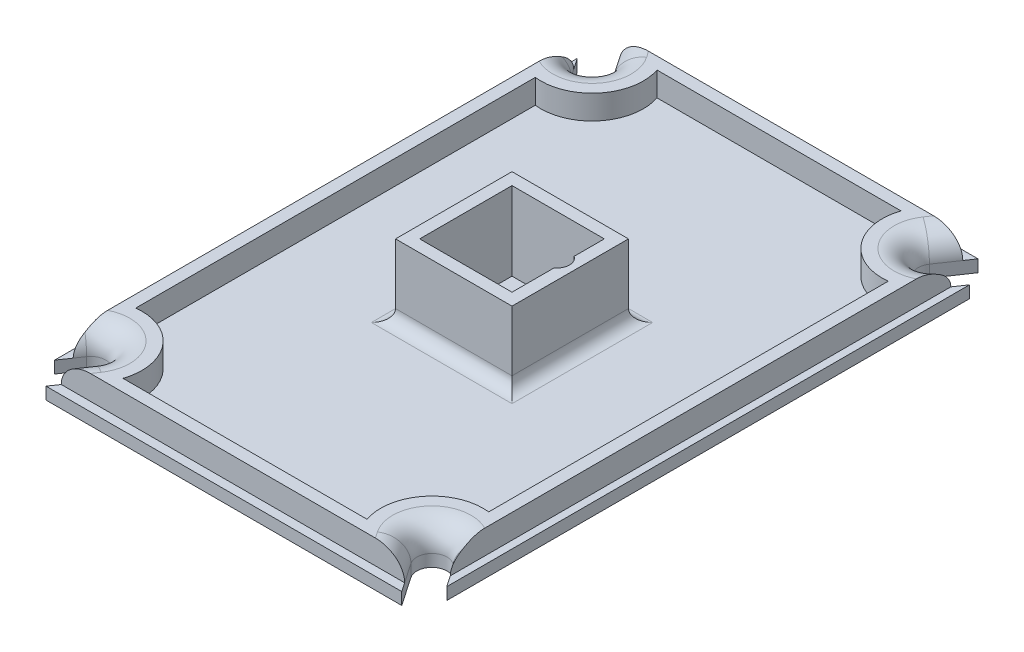
from build123d import *

# Parameters (mm, degrees)
SKETCH1_W           = 65
SKETCH1_H           = 95.5
BOSS_EXTRUDE1_DEPTH = 2
SKETCH1_3_W         = 62.5
SKETCH1_3_H         = 92.5
BOSS_EXTRUDE2_DEPTH = 6
BOSS_EXTRUDE3_START = 6
SKETCH2_4_W         = 19.3
SKETCH2_4_H         = 19.3
BOSS_EXTRUDE3_DEPTH = 8
SKETCH2_R           = 7.65
CUT_EXTRUDE1_DEPTH  = 19.5
CUT_EXTRUDE2_START  = 40
CUT_EXTRUDE2_DEPTH  = 39
CUT_EXTRUDE3_DEPTH  = 10
FILLET1_R           = 4
SKETCH5_W           = 19.3
SKETCH5_H           = 19.3
CUT_EXTRUDE5_DEPTH  = 4
FILLET2_R           = 2


with BuildPart() as part:
    # Sketch1 → Boss-Extrude1 (new body)
    with BuildSketch(Plane(origin=(0, 0, 0), x_dir=(1, 0, 0), z_dir=(0, 1, 0))):
        Rectangle(SKETCH1_W, SKETCH1_H)
    extrude(amount=BOSS_EXTRUDE1_DEPTH)

    # Sketch1<3> → Boss-Extrude2 (add)
    with BuildSketch(Plane(origin=(0, 0, 0), x_dir=(1, 0, 0), z_dir=(0, 1, 0))):
        Rectangle(SKETCH1_3_W, SKETCH1_3_H)
    extrude(amount=BOSS_EXTRUDE2_DEPTH)

    # Sketch2<4> → Boss-Extrude3 (add)
    with BuildSketch(Plane(origin=(0, 0, 0), x_dir=(1, 0, 0), z_dir=(0, 1, 0)).offset(BOSS_EXTRUDE3_START)):
        Rectangle(SKETCH2_4_W, SKETCH2_4_H)
    extrude(amount=BOSS_EXTRUDE3_DEPTH)

    # Sketch2 → Cut-Extrude1 (cut, symmetric)
    with BuildSketch(Plane(origin=(0, 0, 0), x_dir=(1, 0, 0), z_dir=(0, 1, 0))):
        with Locations(Location((0, 0, 0), (0, 0, 270))):
            Circle(SKETCH2_R)
    extrude(amount=CUT_EXTRUDE1_DEPTH, both=True, mode=Mode.SUBTRACT)

    # Sketch2<3> → Cut-Extrude2 (cut)
    with BuildSketch(Plane(origin=(0, 0, 0), x_dir=(1, 0, 0), z_dir=(0, 1, 0)).offset(CUT_EXTRUDE2_START)):
        with BuildLine():
            Line((9e-09, 7.65), (-7.65, 7.65))
            Line((-7.65, 7.65), (-7.65, 0))
            ThreePointArc((-7.65, 0), (-5.409366873, 5.409366879), (9e-09, 7.65))
        make_face()
        with BuildLine():
            Line((7.65, 7.65), (9e-09, 7.65))
            ThreePointArc((9e-09, 7.65), (7.65, 0), (9e-09, -7.65))
            Line((9e-09, -7.65), (7.65, -7.65))
            Line((7.65, -7.65), (7.65, -0.65))
            ThreePointArc((7.65, -0.65), (8.519734544, 1), (7.65, 2.65))
            Line((7.65, 2.65), (7.65, 7.65))
        make_face()
        with BuildLine():
            ThreePointArc((9e-09, -7.65), (-5.409366873, -5.409366879), (-7.65, 0))
            Line((-7.65, 0), (-7.65, -7.65))
            Line((-7.65, -7.65), (9e-09, -7.65))
        make_face()
    extrude(amount=-CUT_EXTRUDE2_DEPTH, mode=Mode.SUBTRACT)

    # Sketch3 → Cut-Extrude3 (cut)
    with BuildSketch(Plane(origin=(0, 0, 0), x_dir=(1, 0, 0), z_dir=(0, 1, 0))):
        with BuildLine():
            Line((-30.433287704, 49.156662819), (-34.566712296, 46.343337181))
            Line((-34.566712296, 46.343337181), (-30.346723838, 40.143200294))
            ThreePointArc((-30.346723838, 40.143200294), (-26.873348724, 39.483150817), (-26.213299247, 42.956525932))
            Line((-26.213299247, 42.956525932), (-30.433287704, 49.156662819))
        make_face()
        with BuildLine():
            Line((34.566712296, 46.343337181), (30.433287704, 49.156662819))
            Line((30.433287704, 49.156662819), (26.213299247, 42.956525932))
            ThreePointArc((26.213299247, 42.956525932), (26.873348724, 39.483150817), (30.346723838, 40.143200294))
            Line((30.346723838, 40.143200294), (34.566712296, 46.343337181))
        make_face()
        with BuildLine():
            Line((-30.346723838, -40.143200294), (-34.566712296, -46.343337181))
            Line((-34.566712296, -46.343337181), (-30.433287704, -49.156662819))
            Line((-30.433287704, -49.156662819), (-26.213299247, -42.956525932))
            ThreePointArc((-26.213299247, -42.956525932), (-26.873348724, -39.483150817), (-30.346723838, -40.143200294))
        make_face()
        with BuildLine():
            Line((26.213299247, -42.956525932), (30.433287704, -49.156662819))
            Line((30.433287704, -49.156662819), (34.566712296, -46.343337181))
            Line((34.566712296, -46.343337181), (30.346723838, -40.143200294))
            ThreePointArc((30.346723838, -40.143200294), (26.873348724, -39.483150817), (26.213299247, -42.956525932))
        make_face()
    extrude(amount=CUT_EXTRUDE3_DEPTH, mode=Mode.SUBTRACT)

    # Fillet1
    # the kernel refuses this fillet: 4 mm, written as the material it takes off along each edge
    with BuildSketch(Plane(origin=(-36.876651276, 6, 49.737170606), x_dir=(0, -1, 0), z_dir=(0.5626651276372232, 0, -0.826684918297768)), Plane(origin=(30.346723838, 6, 40.143200294), x_dir=(0, -1, 0), z_dir=(0.5626651276372238, 0, 0.8266849182977677)), Plane(origin=(36.876651276, 6, -49.737170606), x_dir=(0, -1, 0), z_dir=(-0.562665127637224, 0, 0.8266849182977676)), Plane(origin=(-30.346723838, 6, -40.143200294), x_dir=(0, -1, 0), z_dir=(-0.5626651276372242, 0, -0.8266849182977674))) as fillet1_piece_1:
        with BuildLine():
            CenterArc((FILLET1_R, FILLET1_R), FILLET1_R, 180, 90)
            Line((0, FILLET1_R), (0, 0))
            Line((0, 0), (FILLET1_R, 0))
        make_face()
    extrude(amount=11.605353019, mode=Mode.SUBTRACT)
    with BuildSketch(Plane(origin=(-26.213299247, 6, 42.956525932), x_dir=(0, -1, 0), z_dir=(-0.5626651276372243, 0, 0.8266849182977672)), Plane(origin=(34.081582088, 6, 54.516849183), x_dir=(0, -1, 0), z_dir=(-0.5626651276372246, 0, -0.826684918297767)), Plane(origin=(26.213299247, 6, -42.956525932), x_dir=(0, -1, 0), z_dir=(0.5626651276372232, 0, -0.826684918297768)), Plane(origin=(-34.081582088, 6, -54.516849183), x_dir=(0, -1, 0), z_dir=(0.562665127637224, 0, 0.8266849182977676))) as fillet1_piece_2:
        with BuildLine():
            CenterArc((FILLET1_R, FILLET1_R), FILLET1_R, 180, 90)
            Line((0, FILLET1_R), (0, 0))
            Line((0, 0), (FILLET1_R, 0))
        make_face()
    extrude(amount=13.983953251, mode=Mode.SUBTRACT)
    with BuildSketch(Plane(origin=(-28.280011543, 6, 41.549863113), x_dir=(-0.8266849182977704, 0, -0.5626651276372198), z_dir=(-0.5626651276372198, 0, 0.8266849182977704))) as fillet1_piece_3:
        with BuildLine():
            CenterArc((2.5 + FILLET1_R, FILLET1_R), FILLET1_R, 180, 90)
            Line((2.5 + FILLET1_R, 0), (2.5, 0))
            Line((2.5, 0), (2.5, FILLET1_R))
        make_face()
    revolve(axis=Axis((-28.280011543, 6, 41.549863113), (0, -1, 0)), revolution_arc=180, mode=Mode.SUBTRACT)
    with BuildSketch(Plane(origin=(28.280011543, 6, 41.549863113), x_dir=(-0.8266849182977659, 0, 0.5626651276372262), z_dir=(0.5626651276372262, 0, 0.8266849182977659))) as fillet1_piece_4:
        with BuildLine():
            CenterArc((2.5 + FILLET1_R, FILLET1_R), FILLET1_R, 180, 90)
            Line((2.5 + FILLET1_R, 0), (2.5, 0))
            Line((2.5, 0), (2.5, FILLET1_R))
        make_face()
    revolve(axis=Axis((28.280011543, 6, 41.549863113), (0, -1, 0)), revolution_arc=180, mode=Mode.SUBTRACT)
    with BuildSketch(Plane(origin=(28.280011543, 6, -41.549863113), x_dir=(0.826684918297769, 0, 0.5626651276372218), z_dir=(0.5626651276372218, 0, -0.826684918297769))) as fillet1_piece_5:
        with BuildLine():
            CenterArc((2.5 + FILLET1_R, FILLET1_R), FILLET1_R, 180, 90)
            Line((2.5 + FILLET1_R, 0), (2.5, 0))
            Line((2.5, 0), (2.5, FILLET1_R))
        make_face()
    revolve(axis=Axis((28.280011543, 6, -41.549863113), (0, -1, 0)), revolution_arc=180, mode=Mode.SUBTRACT)
    with BuildSketch(Plane(origin=(-28.280011543, 6, -41.549863113), x_dir=(0.8266849182977655, 0, -0.562665127637227), z_dir=(-0.562665127637227, 0, -0.8266849182977655))) as fillet1_piece_6:
        with BuildLine():
            CenterArc((2.5 + FILLET1_R, FILLET1_R), FILLET1_R, 180, 90)
            Line((2.5 + FILLET1_R, 0), (2.5, 0))
            Line((2.5, 0), (2.5, FILLET1_R))
        make_face()
    revolve(axis=Axis((-28.280011543, 6, -41.549863113), (0, -1, 0)), revolution_arc=180, mode=Mode.SUBTRACT)

    # Sketch5 → Cut-Extrude5 (cut)
    with BuildSketch(Plane(origin=(0, 6, 0), x_dir=(1, 0, 0), z_dir=(0, 1, 0))):
        with BuildLine():
            Line((-20.220280729, -44.25), (20.220280729, -44.25))
            ThreePointArc((20.220280729, -44.25), (21.675717981, -36.198853249), (29.25, -33.105390223))
            Line((29.25, -33.105390223), (29.25, 33.105390223))
            ThreePointArc((29.25, 33.105390223), (21.675717981, 36.198853249), (20.220280729, 44.25))
            Line((20.220280729, 44.25), (-20.220280729, 44.25))
            ThreePointArc((-20.220280729, 44.25), (-21.675717981, 36.198853249), (-29.25, 33.105390223))
            Line((-29.25, 33.105390223), (-29.25, -33.105390223))
            ThreePointArc((-29.25, -33.105390223), (-21.675717981, -36.198853249), (-20.220280729, -44.25))
        make_face()
        Rectangle(SKETCH5_W, SKETCH5_H, mode=Mode.SUBTRACT)
    extrude(amount=-CUT_EXTRUDE5_DEPTH, mode=Mode.SUBTRACT)

    # Fillet2
    fillet2_edges = [part.edges().sort_by_distance(p)[0] for p in [
        (0, 2, -9.65),
        (-9.65, 2, 0),
        (0, 2, 9.65),
        (9.65, 2, 0),
    ]]
    fillet(fillet2_edges, radius=FILLET2_R)


solid = part.part
